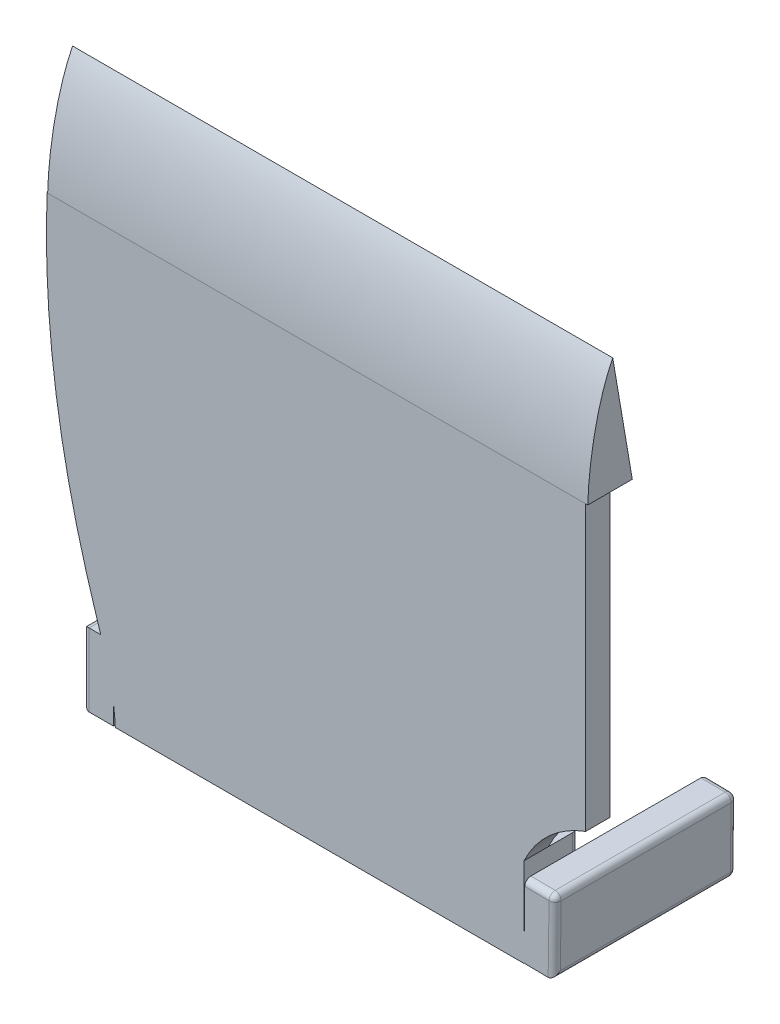
from build123d import *

# Parameters (mm, degrees)
BOSS_EXTRUDE1_DEPTH     = 4
BOSS_EXTRUDE2_DEPTH     = 44.5
SKETCH3_W               = 5.0000000000000036
SKETCH3_H               = 27.836210210818138
BOSS_EXTRUDE3_DEPTH     = 5
BOSS_EXTRUDE4_DEPTH     = 5
BOSS_EXTRUDE5_DEPTH     = 5
FILLET1_R               = 1
CUT_EXTRUDE1_DEPTH      = 31.000000000000007
CUT_EXTRUDE1_DEPTH_BACK = 92.00000000000006


with BuildPart() as part:
    # Sketch1 → Boss-Extrude1 (new body)
    with BuildSketch(Plane.XY):
        with BuildLine():
            Line((44.13819654508905, -8.587322623235597), (44.138196545089066, 38.18135244346883))
            Line((44.138196545089066, 38.18135244346883), (-44.59047345491093, 38.1813524434688))
            add(Edge.make_bspline(
                [(-44.59047345491093, 38.1813524434688), (-45.00113120590206, 27.807344064017013), (-43.80079897086652, 9.716786167588085), (-37.87071079954606, -15.323106674011775), (-32.34132223453384, -29.951104050025897), (-33.66591516868294, -37.89370755653117)],
                knots=[0, 0, 0, 0, 0.4033279806139027, 0.6984792830312921, 1, 1, 1, 1], degree=3))
            Line((-33.66591516868294, -37.89370755653117), (-33.665915168682936, -45.6483234271737))
            Line((-33.665915168682936, -45.6483234271737), (33.79527853249684, -45.6483234271737))
            Line((33.79527853249684, -45.6483234271737), (34.01182211372463, -29.180849164592967))
            Line((34.01182211372463, -29.180849164592967), (34.01182211372463, -17.812113216355563))
            ThreePointArc((34.01182211372463, -17.812113216355563), (38.15712837199417, -12.192127973514067), (44.13819654508905, -8.587322623235597))
        make_face()
    extrude(amount=BOSS_EXTRUDE1_DEPTH)

    # Sketch2 → Boss-Extrude2 (add, symmetric)
    with BuildSketch(Plane(origin=(0, 0, 0), x_dir=(0, 0, -1), z_dir=(1, 0, 0))):
        with BuildLine():
            Line((3.3299999999999996, 38.18135244346883), (0.11029619723043615, 57.11961021503882))
            add(Edge.make_bspline(
                [(0.11029619723043615, 57.11961021503882), (-1.7342738946009746, 53.54678225172393), (-3.1480765948589604, 48.22246144436939), (-3.870018399246021, 42.77781700295033), (-4, 38.18135244346883)],
                knots=[0, 0, 0, 0, 0, 1, 1, 1, 1, 1], degree=4))
            Line((-4, 38.18135244346883), (3.3299999999999996, 38.18135244346883))
        make_face()
    extrude(amount=BOSS_EXTRUDE2_DEPTH, both=True)

    # Sketch3 → Boss-Extrude3 (add)
    with BuildSketch(Plane(origin=(0, 0, 0), x_dir=(-1, 0, 0), z_dir=(0, 0, -1))):
        Polygon((-29.011822113724623, -17.812113216355563), (-34.01182211372463, -17.812113216355563), (-34.01182211372463, -45.6483234271737), (-29.01182211372462, -45.6483234271737), align=None)
        with Locations((31.165915168682936, -31.73021832176463)):
            Rectangle(SKETCH3_W, SKETCH3_H)
    extrude(amount=BOSS_EXTRUDE3_DEPTH)

    # Sketch4 → Boss-Extrude4 (add)
    with BuildSketch(Plane(origin=(34.389597182681534, -0.45221546499334564, 0), x_dir=(0, 0, -1), z_dir=(0.999913552919778, -0.013148638231635975, 0))):
        Polygon((-4, -19.994817670720977), (26, -19.994817670720977), (26.000000000000004, -31.994817670720973), (-3.9999999999999982, -31.994817670720973), align=None)
    extrude(amount=BOSS_EXTRUDE4_DEPTH)

    # Sketch5 → Boss-Extrude5 (add)
    with BuildSketch(Plane.ZY.offset(33.66591516868297)):
        Polygon((-26, -20.44530464210715), (3.999999999999999, -20.44530464210715), (4, -32.44530464210715), (-25.999999999999996, -32.44530464210715), align=None)
    extrude(amount=BOSS_EXTRUDE5_DEPTH)

    # Fillet1
    fillet1_edges = [part.edges().sort_by_distance(p)[0] for p in [
        (-38.66591516868295, -26.44530464210719, 3.9999999999999996),
        (-38.66591516868295, -20.445304642107185, -11),
        (-38.66591516868294, -32.44530464210719, -10.999999999999998),
        (-38.66591516868295, -26.44530464210719, -26),
    ]]
    fillet(fillet1_edges, radius=FILLET1_R)
    fillet1_2_edges = [part.edges().sort_by_distance(p)[0] for p in [
        (39.047368493830774, -26.510529150783963, 3.999999999999999),
        (36.626476440921145, -20.478176237686206, 4),
        (34.04780072923189, -26.444785959625783, -26),
        (36.626476440921145, -20.478176237686206, -26),
        (39.126260323220585, -20.511047833265298, -11),
        (39.047368493830774, -26.510529150783963, -26),
        (38.968476664440956, -32.51001046830263, -11.000000000000004),
        (36.46869278214152, -32.477138872723536, -26.000000000000004),
    ]]
    fillet(fillet1_2_edges, radius=FILLET1_R)
    fillet1_3_edges = [part.edges().sort_by_distance(p)[0] for p in [
        (34.01182211372463, -45.6483234271737, -2.5),
        (31.511822113724623, -45.6483234271737, -5),
        (34.01182211372463, -39.04657750171243, -5),
    ]]
    fillet(fillet1_3_edges, radius=FILLET1_R)
    fillet1_4_edges = [part.edges().sort_by_distance(p)[0] for p in [
        (-31.165915168682936, -45.6483234271737, -5),
        (-33.665915168682936, -39.04681403464044, -5),
    ]]
    fillet(fillet1_4_edges, radius=FILLET1_R)
    fillet1_5_edges = [part.edges().sort_by_distance(p)[0] for p in [
        (-33.66591516868295, -20.44530464210718, -15.5),
        (-33.66591516868295, -26.445304642107182, -26),
    ]]
    fillet(fillet1_5_edges, radius=FILLET1_R)

    # Sketch6 → Cut-Extrude1 (cut, two sides: drawn at the far end of the back side and taken through both)
    with BuildSketch(Plane(origin=(34.01182211372463, 0, 0), x_dir=(0, 0, -1), z_dir=(1, 0, 0)).offset(-CUT_EXTRUDE1_DEPTH_BACK)):
        Polygon((-7.49196381831041, -32.49686183007099), (14.086212890543237, -32.49686183007099), (14.086212890543239, -55.32846200135615), (-7.491963818310407, -55.32846200135615), align=None)
    extrude(amount=CUT_EXTRUDE1_DEPTH + CUT_EXTRUDE1_DEPTH_BACK, mode=Mode.SUBTRACT)


solid = part.part
